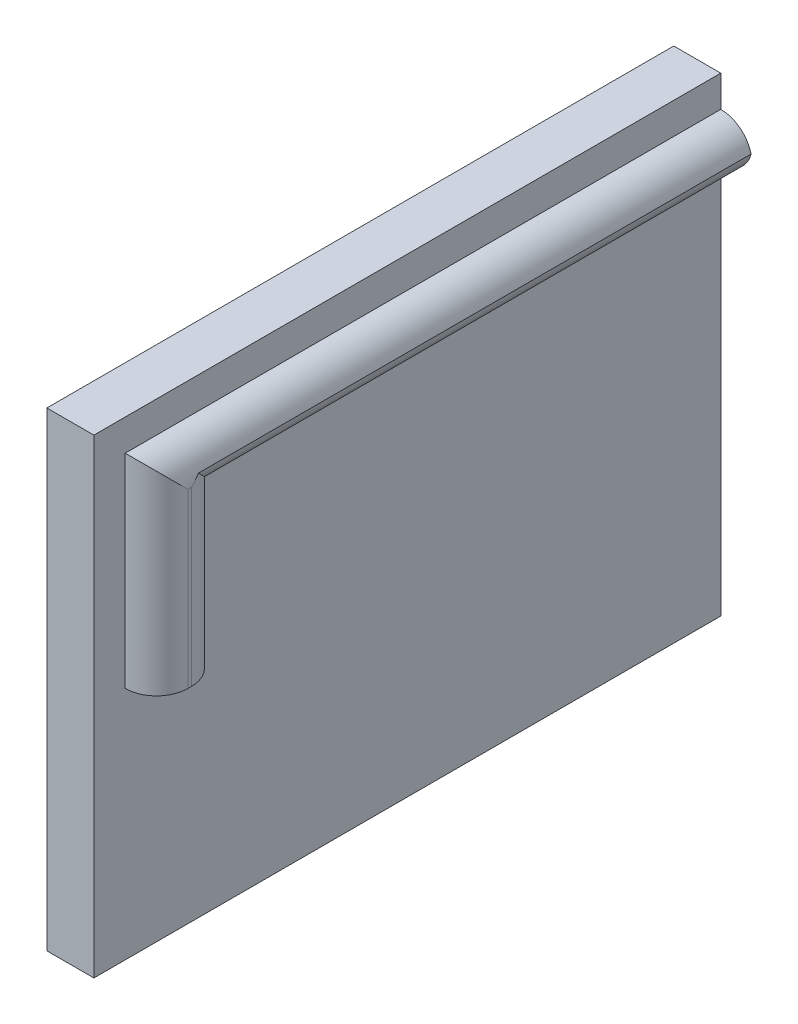
from build123d import *

# Parameters (mm, degrees)
SKETCH1_W           = 40
SKETCH1_H           = 30
BOSS_EXTRUDE1_DEPTH = 3
BOSS_EXTRUDE2_DEPTH = 2
FILLET1_R           = 2


with BuildPart() as part:
    # Sketch1 → Boss-Extrude1 (new body)
    with BuildSketch(Plane(origin=(0, 0, 0), x_dir=(0, 0, -1), z_dir=(1, 0, 0))):
        Rectangle(SKETCH1_W, SKETCH1_H)
    extrude(amount=BOSS_EXTRUDE1_DEPTH)

    # Sketch2 → Boss-Extrude2 (add)
    with BuildSketch(Plane(origin=(3, 0, 0), x_dir=(0, 0, -1), z_dir=(1, 0, 0))):
        Polygon((20, 10), (20, 13), (-13.768503326, 13), (-18, 13), (-18, 10), (-18, 0), (-13.768503326, 0), (-13.768503326, 10), align=None)
    extrude(amount=BOSS_EXTRUDE2_DEPTH)

    # Fillet1
    # the kernel refuses this fillet: 2 mm, written as the material it takes off along each edge
    with BuildSketch(Plane(origin=(5, -5, 18), x_dir=(-1, 0, 0), z_dir=(0, 1, 0))) as fillet1_piece_1:
        with BuildLine():
            CenterArc((FILLET1_R, -FILLET1_R), FILLET1_R, 90, 90)
            Line((0, -FILLET1_R), (0, 0))
            Line((0, 0), (FILLET1_R, 0))
        make_face()
    extrude(amount=23, mode=Mode.SUBTRACT)
    with BuildSketch(Plane(origin=(5, -5, 13.768503326), x_dir=(-1, 0, 0), z_dir=(0, 1, 0))) as fillet1_piece_2:
        with BuildLine():
            CenterArc((FILLET1_R, FILLET1_R), FILLET1_R, 180, 90)
            Line((0, FILLET1_R), (0, 0))
            Line((0, 0), (FILLET1_R, 0))
        make_face()
    extrude(amount=15, mode=Mode.SUBTRACT)
    with BuildSketch(Plane(origin=(5, 10, 13.768503326), x_dir=(-1, 0, 0), z_dir=(0, 0, -1))) as fillet1_piece_3:
        with BuildLine():
            CenterArc((FILLET1_R, FILLET1_R), FILLET1_R, 180, 90)
            Line((0, FILLET1_R), (0, 0))
            Line((0, 0), (FILLET1_R, 0))
        make_face()
    extrude(amount=38.768503326, mode=Mode.SUBTRACT)
    with BuildSketch(Plane(origin=(5, 13, 23), x_dir=(-1, 0, 0), z_dir=(0, 0, -1))) as fillet1_piece_4:
        with BuildLine():
            CenterArc((FILLET1_R, -FILLET1_R), FILLET1_R, 90, 90)
            Line((0, -FILLET1_R), (0, 0))
            Line((0, 0), (FILLET1_R, 0))
        make_face()
    extrude(amount=48, mode=Mode.SUBTRACT)
    with BuildSketch(Plane(origin=(5, 10, 18.768503326), x_dir=(-1, 0, 0), z_dir=(0, 0, -1))) as fillet1_piece_5a_section:
        with BuildLine():
            CenterArc((FILLET1_R, FILLET1_R), FILLET1_R, 180, 90)
            Line((0, FILLET1_R), (0, 0))
            Line((0, 0), (FILLET1_R, 0))
        make_face()
    fillet1_piece_5a = extrude(amount=43.768503326, mode=Mode.PRIVATE)
    fillet1_piece_5a = split(fillet1_piece_5a, bisect_by=Plane(origin=(4.547209771, 10.452790229, 13.768503326), z_dir=(0, 0, 1)), keep=Keep.TOP, mode=Mode.PRIVATE)
    with BuildSketch(Plane(origin=(5, -5, 13.768503326), x_dir=(-1, 0, 0), z_dir=(0, 1, 0))) as fillet1_piece_5b_section:
        with BuildLine():
            CenterArc((FILLET1_R, FILLET1_R), FILLET1_R, 180, 90)
            Line((0, FILLET1_R), (0, 0))
            Line((0, 0), (FILLET1_R, 0))
        make_face()
    fillet1_piece_5b = extrude(amount=20, mode=Mode.PRIVATE)
    fillet1_piece_5b = split(fillet1_piece_5b, bisect_by=Plane(origin=(4.547209771, 10, 14.221293555), z_dir=(0, 1, 0)), keep=Keep.TOP, mode=Mode.PRIVATE)
    fillet1_piece_5 = fillet1_piece_5a & fillet1_piece_5b
    add(fillet1_piece_5, mode=Mode.SUBTRACT)


solid = part.part
